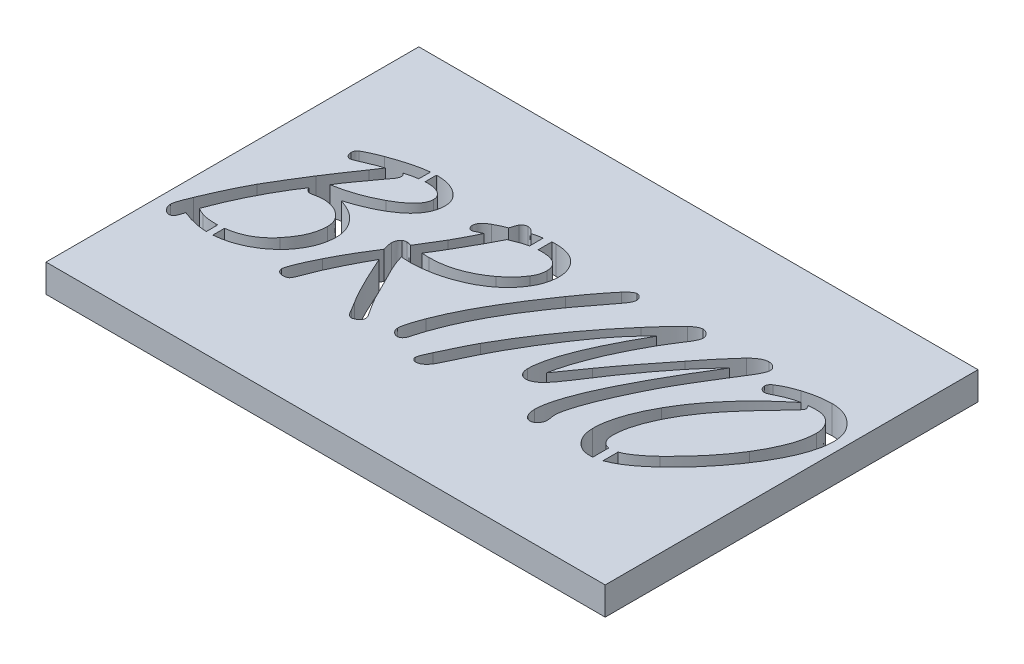
from build123d import *

# Parameters (mm, degrees)
SKETCH1_W           = 30
SKETCH1_H           = 20
BOSS_EXTRUDE1_DEPTH = 1.5
CUT_EXTRUDE1_REACH  = 20.09
SKETCH3_W           = 0.33849078
SKETCH3_H           = 1.82785021
SKETCH3_W_2         = 0.304641701
SKETCH3_H_2         = 1.65860482
SKETCH3_W_3         = 0.406188936
SKETCH3_H_3         = 1.624755742
SKETCH3_W_4         = 0.440038013
SKETCH3_H_4         = 2.200190067
BOSS_EXTRUDE2_DEPTH = 1.5


with BuildPart() as part:
    # Sketch1 → Boss-Extrude1 (new body)
    with BuildSketch(Plane(origin=(0, 0, 0), x_dir=(1, 0, 0), z_dir=(0, 1, 0))):
        Rectangle(SKETCH1_W, SKETCH1_H)
    extrude(amount=BOSS_EXTRUDE1_DEPTH)

    # Sketch2 → Cut-Extrude1 (cut, up to next)
    with BuildSketch(Plane(origin=(0, 1.5, 0), x_dir=(1, 0, 0), z_dir=(0, 1, 0)), mode=Mode.PRIVATE) as cut_extrude1_sk1:
        with BuildLine():
            add(Edge.make_bspline(
                [(-9.932411562, 0.772093525), (-9.734922443, 0.704966672), (-9.379290774, 0.564523072), (-9.062896987, 0.348333913), (-8.939933851, 0.228139394)],
                knots=[0, 0, 0, 0, 0.549380388, 1, 1, 1, 1], degree=3))
            add(Edge.make_bspline(
                [(-8.939933851, 0.228139394), (-8.849928235, 0.139025577), (-8.723492783, -0.000773987), (-8.589062537, -0.207507726), (-8.507650825, -0.366046446), (-8.444563721, -0.529772722), (-8.38551799, -0.757641725), (-8.36781636, -0.934041361), (-8.367350555, -1.052538576)],
                knots=[0, 0, 0, 0, 0.263597717, 0.389785508, 0.511629438, 0.633451834, 0.753742721, 1, 1, 1, 1], degree=3))
            add(Edge.make_bspline(
                [(-8.367350555, -1.052538576), (-8.367907264, -1.197626654), (-8.386165549, -1.41472705), (-8.444352044, -1.698780494), (-8.507863392, -1.908245116), (-8.591319484, -2.113945508), (-8.721756628, -2.391869243), (-8.849344856, -2.587824822), (-8.941842462, -2.714938744)],
                knots=[0, 0, 0, 0, 0.243209893, 0.36414387, 0.485641208, 0.609655764, 0.736110452, 1, 1, 1, 1], degree=3))
            add(Edge.make_bspline(
                [(-8.941842462, -2.714938744), (-9.118329378, -2.955076763), (-9.537742468, -3.391966789), (-10.043554258, -3.724934564), (-10.31604237, -3.860105334)],
                knots=[0, 0, 0, 0, 0.49477109, 1, 1, 1, 1], degree=3))
            add(Edge.make_bspline(
                [(-10.31604237, -3.860105334), (-10.588241604, -3.996085229), (-11.153877319, -4.21133777), (-11.755102182, -4.280881661), (-12.050969755, -4.281908362)],
                knots=[0, 0, 0, 0, 0.507133392, 1, 1, 1, 1], degree=3))
            add(Edge.make_bspline(
                [(-12.050969755, -4.281908362), (-12.292539564, -4.281821037), (-12.803031864, -4.216145988), (-13.293065705, -4.059517856), (-13.543503545, -3.955535884)],
                knots=[0, 0, 0, 0, 0.470723175, 1, 1, 1, 1], degree=3))
            add(Edge.make_bspline(
                [(-13.543503545, -3.955535884), (-13.563516042, -4.002731317), (-13.58401121, -4.081355243), (-13.614036235, -4.156900722), (-13.619847984, -4.186477813)],
                knots=[0, 0, 0, 0, 0.630095785, 1, 1, 1, 1], degree=3))
            add(Edge.make_bspline(
                [(-13.619847984, -4.186477813), (-13.644480231, -4.26629225), (-13.701584488, -4.411365898), (-13.837980731, -4.49190886), (-13.904231021, -4.488038348)],
                knots=[0, 0, 0, 0, 0.574548178, 1, 1, 1, 1], degree=3))
            add(Edge.make_bspline(
                [(-13.904231021, -4.488038348), (-13.970443515, -4.489457698), (-14.109552839, -4.44512091), (-14.20826649, -4.338308909), (-14.249689609, -4.276182529)],
                knots=[0, 0, 0, 0, 0.465807359, 1, 1, 1, 1], degree=3))
            add(Edge.make_bspline(
                [(-14.249689609, -4.276182529), (-14.346980591, -4.140746557), (-14.352754602, -3.974621993)],
                knots=[0, 0, 0, 1, 1, 1], degree=2))
            add(Edge.make_bspline(
                [(-14.352754602, -3.974621993), (-14.353987257, -3.926006953), (-14.337711204, -3.847062033), (-14.310433019, -3.731276582), (-14.275033217, -3.622393778), (-14.232763968, -3.496950023), (-14.161094823, -3.298065206), (-14.092168737, -3.145019308), (-14.049285456, -3.035585389)],
                knots=[0, 0, 0, 0, 0.146035373, 0.243207789, 0.360183195, 0.492362495, 0.644091985, 1, 1, 1, 1], degree=3))
            add(Edge.make_bspline(
                [(-14.049285456, -3.035585389), (-13.950985831, -2.802695194), (-13.805866263, -2.463136544), (-13.610325533, -2.026025995), (-13.470337877, -1.728218258), (-13.336757805, -1.44954224), (-13.173165128, -1.114839692), (-13.046015235, -0.877108513), (-12.961377195, -0.726166098)],
                knots=[0, 0, 0, 0, 0.296923744, 0.433727894, 0.562436716, 0.683432254, 0.796726641, 1, 1, 1, 1], degree=3))
            add(Edge.make_bspline(
                [(-12.961377195, -0.726166098), (-12.901896868, -0.619005257), (-12.800762443, -0.445297068), (-12.652582949, -0.194561766), (-12.509925662, 0.035386032), (-12.352952852, 0.297885607), (-12.100501719, 0.703093337), (-11.90230717, 1.022009126), (-11.762769496, 1.243520438)],
                knots=[0, 0, 0, 0, 0.159440585, 0.26150338, 0.37890007, 0.5114824, 0.659407442, 1, 1, 1, 1], degree=3))
            add(Edge.make_bspline(
                [(-11.762769496, 1.243520438), (-11.690554557, 1.358424372), (-11.573934626, 1.53644885), (-11.410511136, 1.782516741), (-11.2726733, 1.989429928), (-11.124234366, 2.210488963), (-10.903779312, 2.533266977), (-10.730369133, 2.780455239), (-10.613785684, 2.951727269)],
                knots=[0, 0, 0, 0, 0.197743422, 0.310104099, 0.430435127, 0.560023408, 0.698104168, 1, 1, 1, 1], degree=3))
            add(Edge.make_bspline(
                [(-10.613785684, 2.951727269), (-10.43494449, 3.206622426), (-10.270235707, 3.470869456)],
                knots=[0, 0, 0, 1, 1, 1], degree=2))
            add(Edge.make_bspline(
                [(-10.270235707, 3.470869456), (-10.401765356, 3.432653795), (-10.691313001, 3.325587509), (-10.976077772, 3.206746194), (-11.132927872, 3.136862534)],
                knots=[0, 0, 0, 0, 0.443552837, 1, 1, 1, 1], degree=3))
            add(Edge.make_bspline(
                [(-11.132927872, 3.136862534), (-11.248375573, 3.0843222), (-11.419870602, 3.017791597), (-11.593586075, 2.952209285), (-11.652070059, 2.946001436)],
                knots=[0, 0, 0, 0, 0.684267816, 1, 1, 1, 1], degree=3))
            add(Edge.make_bspline(
                [(-11.652070059, 2.946001436), (-11.762863837, 2.952888006), (-11.831479492, 3.041431985)],
                knots=[0, 0, 0, 1, 1, 1], degree=2))
            add(Edge.make_bspline(
                [(-11.831479492, 3.041431985), (-11.908514756, 3.140798702), (-11.907823931, 3.266648081)],
                knots=[0, 0, 0, 1, 1, 1], degree=2))
            add(Edge.make_bspline(
                [(-11.907823931, 3.266648081), (-11.906838025, 3.324020662), (-11.889786006, 3.440246881), (-11.808168266, 3.524857126), (-11.762769496, 3.552939729)],
                knots=[0, 0, 0, 0, 0.520839349, 1, 1, 1, 1], degree=3))
            add(Edge.make_bspline(
                [(-11.762769496, 3.552939729), (-11.645335445, 3.626368505), (-11.337675073, 3.78437993), (-11.015051875, 3.908712824), (-10.821824281, 3.9823772)],
                knots=[0, 0, 0, 0, 0.400792134, 1, 1, 1, 1], degree=3))
            add(Edge.make_bspline(
                [(-10.821824281, 3.9823772), (-10.59891412, 4.062491854), (-10.275121161, 4.182945908), (-9.845503332, 4.303683476), (-9.552522633, 4.38270017), (-9.27493548, 4.438874294), (-8.941278792, 4.494620128), (-8.697451556, 4.513347928), (-8.541034155, 4.512971054)],
                knots=[0, 0, 0, 0, 0.302190604, 0.439786841, 0.568841533, 0.688942376, 0.800686413, 1, 1, 1, 1], degree=3))
            add(Edge.make_bspline(
                [(-8.541034155, 4.512971054), (-8.318813715, 4.511629255), (-7.896315658, 4.472283719), (-7.512243516, 4.290299174), (-7.355786734, 4.173238299)],
                knots=[0, 0, 0, 0, 0.533747536, 1, 1, 1, 1], degree=3))
            add(Edge.make_bspline(
                [(-7.355786734, 4.173238299), (-7.284878907, 4.119338616), (-7.18431349, 4.032911794), (-7.078393914, 3.896915271), (-7.011982214, 3.793582292), (-6.961860527, 3.683694428), (-6.916061927, 3.528042107), (-6.901603736, 3.40611682), (-6.901537319, 3.323906411)],
                knots=[0, 0, 0, 0, 0.267458389, 0.393646815, 0.515248226, 0.634634543, 0.754005651, 1, 1, 1, 1], degree=3))
            add(Edge.make_bspline(
                [(-6.901537319, 3.323906411), (-6.901908339, 3.151241789), (-6.943010372, 2.890257945), (-7.081888539, 2.566237613), (-7.228155541, 2.332143313), (-7.415997886, 2.108012107), (-7.732713098, 1.808728284), (-8.016211109, 1.620712148), (-8.216570288, 1.501182921)],
                knots=[0, 0, 0, 0, 0.219658989, 0.331395792, 0.446658753, 0.569711962, 0.702581043, 1, 1, 1, 1], degree=3))
            add(Edge.make_bspline(
                [(-8.216570288, 1.501182921), (-8.481220011, 1.344103101), (-9.042256473, 1.071101762), (-9.628218225, 0.856802252), (-9.932411562, 0.772093525)],
                knots=[0, 0, 0, 0, 0.493549598, 1, 1, 1, 1], degree=3))
        make_face()
        with BuildLine():
            add(Edge.make_bspline(
                [(-10.968787327, 1.214891273), (-10.580239876, 1.280848353), (-9.811278378, 1.47308783), (-9.086709916, 1.794688255), (-8.739529697, 1.9840615)],
                knots=[0, 0, 0, 0, 0.499167028, 1, 1, 1, 1], degree=3))
            add(Edge.make_bspline(
                [(-8.739529697, 1.9840615), (-8.553842476, 2.083101508), (-8.297379063, 2.240139228), (-7.995893122, 2.47201528), (-7.822295054, 2.639486663), (-7.683701473, 2.804682676), (-7.557933198, 3.02097862), (-7.511037706, 3.195809836), (-7.512292834, 3.310546134)],
                knots=[0, 0, 0, 0, 0.334645337, 0.477361692, 0.604032632, 0.717668097, 0.819210988, 1, 1, 1, 1], degree=3))
            add(Edge.make_bspline(
                [(-7.512292834, 3.310546134), (-7.512690218, 3.405625607), (-7.568433928, 3.613709468), (-7.74527836, 3.737308617), (-7.836756702, 3.78769888)],
                knots=[0, 0, 0, 0, 0.47272119, 1, 1, 1, 1], degree=3))
            add(Edge.make_bspline(
                [(-7.836756702, 3.78769888), (-7.91640754, 3.829234097), (-8.111535568, 3.890944034), (-8.315628421, 3.900497138), (-8.428426107, 3.902215539)],
                knots=[0, 0, 0, 0, 0.441874031, 1, 1, 1, 1], degree=3))
            add(Edge.make_bspline(
                [(-8.428426107, 3.902215539), (-8.605843561, 3.903234173), (-8.987329649, 3.862066424), (-9.359845502, 3.771340749), (-9.556415199, 3.71135444)],
                knots=[0, 0, 0, 0, 0.462913354, 1, 1, 1, 1], degree=3))
            add(Edge.make_bspline(
                [(-9.556415199, 3.71135444), (-9.52029987, 3.688080547), (-9.460008056, 3.628997815), (-9.435543783, 3.548024685), (-9.436172706, 3.509041676)],
                knots=[0, 0, 0, 0, 0.526905379, 1, 1, 1, 1], degree=3))
            add(Edge.make_bspline(
                [(-9.436172706, 3.509041676), (-9.44003055, 3.440617254), (-9.495459905, 3.276389704), (-9.607324279, 3.144545113), (-9.669023247, 3.064335317)],
                knots=[0, 0, 0, 0, 0.400175617, 1, 1, 1, 1], degree=3))
            add(Edge.make_bspline(
                [(-9.669023247, 3.064335317), (-9.705752028, 3.01809389), (-9.798377785, 2.893009368), (-9.890132148, 2.767305174), (-9.945771839, 2.688338953)],
                knots=[0, 0, 0, 0, 0.379369887, 1, 1, 1, 1], degree=3))
            add(Edge.make_bspline(
                [(-9.945771839, 2.688338953), (-9.966055172, 2.660515777), (-9.996622024, 2.609383414), (-10.049857582, 2.537362534), (-10.104205004, 2.464239405), (-10.165964122, 2.376821057), (-10.269155131, 2.236305461), (-10.352052509, 2.125582477), (-10.409564308, 2.047045662)],
                knots=[0, 0, 0, 0, 0.130417069, 0.225441192, 0.339257826, 0.475767101, 0.631065693, 1, 1, 1, 1], degree=3))
            add(Edge.make_bspline(
                [(-10.409564308, 2.047045662), (-10.522937571, 1.894215968), (-10.718008956, 1.622460146), (-10.896930944, 1.339792298), (-10.968787327, 1.214891273)],
                knots=[0, 0, 0, 0, 0.569144572, 1, 1, 1, 1], degree=3))
        make_face(mode=Mode.SUBTRACT)
        with BuildLine():
            add(Edge.make_bspline(
                [(-13.375545778, -3.396312865), (-13.308996022, -3.435608537), (-13.192577438, -3.489816722), (-13.076806058, -3.54562316), (-13.028178579, -3.562362021)],
                knots=[0, 0, 0, 0, 0.600477991, 1, 1, 1, 1], degree=3))
            add(Edge.make_bspline(
                [(-13.028178579, -3.562362021), (-12.915175566, -3.602513301), (-12.651814872, -3.660773776), (-12.382500723, -3.668398525), (-12.23419641, -3.671152847)],
                knots=[0, 0, 0, 0, 0.446321071, 1, 1, 1, 1], degree=3))
            add(Edge.make_bspline(
                [(-12.23419641, -3.671152847), (-11.998570944, -3.668945594), (-11.648826949, -3.643241244), (-11.205710921, -3.524515196), (-10.897201968, -3.406949349), (-10.607718349, -3.254243214), (-10.242209855, -3.003009193), (-10.003891331, -2.764495983), (-9.859884345, -2.59087903)],
                knots=[0, 0, 0, 0, 0.2622613, 0.386546348, 0.508478145, 0.628294186, 0.749249156, 1, 1, 1, 1], degree=3))
            add(Edge.make_bspline(
                [(-9.859884345, -2.59087903), (-9.739428686, -2.446896511), (-9.576843708, -2.224848554), (-9.394520707, -1.916652806), (-9.287290574, -1.691121868), (-9.20433338, -1.466188925), (-9.125960144, -1.171006021), (-9.098832135, -0.945740316), (-9.100257173, -0.796784705)],
                knots=[0, 0, 0, 0, 0.283178931, 0.414402904, 0.539790953, 0.659455139, 0.775649605, 1, 1, 1, 1], degree=3))
            add(Edge.make_bspline(
                [(-9.100257173, -0.796784705), (-9.100920286, -0.701132167), (-9.117000104, -0.558295583), (-9.17895005, -0.379933885), (-9.243683828, -0.256078988), (-9.323417217, -0.138573656), (-9.462300404, 0.008792654), (-9.588239456, 0.10027809), (-9.678566302, 0.155612177)],
                knots=[0, 0, 0, 0, 0.24566119, 0.364900079, 0.482428716, 0.603309602, 0.728040986, 1, 1, 1, 1], degree=3))
            add(Edge.make_bspline(
                [(-9.678566302, 0.155612177), (-9.792993305, 0.225941596), (-10.054700056, 0.329119336), (-10.333915336, 0.359228175), (-10.478274304, 0.359833552)],
                knots=[0, 0, 0, 0, 0.481057088, 1, 1, 1, 1], degree=3))
            add(Edge.make_bspline(
                [(-10.478274304, 0.359833552), (-10.550545611, 0.360065275), (-10.723623634, 0.342604219), (-10.893988447, 0.308385339), (-10.99359927, 0.289214946)],
                knots=[0, 0, 0, 0, 0.415623019, 1, 1, 1, 1], degree=3))
            add(Edge.make_bspline(
                [(-10.99359927, 0.289214946), (-11.055984099, 0.27687241), (-11.119567595, 0.275854669)],
                knots=[0, 0, 0, 1, 1, 1], degree=2))
            add(Edge.make_bspline(
                [(-11.119567595, 0.275854669), (-11.177380583, 0.271924679), (-11.294591777, 0.331356932), (-11.369141284, 0.436742491), (-11.398224798, 0.501070765)],
                knots=[0, 0, 0, 0, 0.439945867, 1, 1, 1, 1], degree=3))
            add(Edge.make_bspline(
                [(-11.398224798, 0.501070765), (-11.498099609, 0.360534755), (-11.647133079, 0.13858681), (-11.83973942, -0.176246001), (-11.993545276, -0.439499763), (-12.154535674, -0.720952073), (-12.375414338, -1.135819467), (-12.542768094, -1.456463944), (-12.652182215, -1.678562979)],
                knots=[0, 0, 0, 0, 0.205494641, 0.318510648, 0.439849182, 0.568892532, 0.704939884, 1, 1, 1, 1], degree=3))
            add(Edge.make_bspline(
                [(-12.652182215, -1.678562979), (-12.777599119, -1.9379236), (-13.038931949, -2.502280157), (-13.258886865, -3.0840647), (-13.375545778, -3.396312865)],
                knots=[0, 0, 0, 0, 0.463573793, 1, 1, 1, 1], degree=3))
        make_face(mode=Mode.SUBTRACT)
    cut_extrude1_tool1 = extrude(cut_extrude1_sk1.sketch, amount=-CUT_EXTRUDE1_REACH, mode=Mode.PRIVATE) & part.part
    # Sketch2 → Cut-Extrude1 (cut, up to next)
    with BuildSketch(Plane(origin=(0, 1.5, 0), x_dir=(1, 0, 0), z_dir=(0, 1, 0)), mode=Mode.PRIVATE) as cut_extrude1_sk2:
        with BuildLine():
            add(Edge.make_bspline(
                [(-6.187716811, -0.945656361), (-6.329970155, -1.203003673), (-6.532999847, -1.579562743), (-6.786317377, -2.071443161), (-6.952063906, -2.408844563), (-7.101265736, -2.725587371), (-7.270336095, -3.104718665), (-7.382865352, -3.381208427), (-7.447400061, -3.56045341)],
                knots=[0, 0, 0, 0, 0.303657402, 0.441760373, 0.571337763, 0.691839577, 0.803309128, 1, 1, 1, 1], degree=3))
            add(Edge.make_bspline(
                [(-7.447400061, -3.56045341), (-7.477914059, -3.6449393), (-7.523254639, -3.76341957), (-7.581641744, -3.910554675), (-7.621619869, -3.996627644), (-7.651742878, -4.069660976), (-7.687958474, -4.133766177), (-7.713377627, -4.173577114), (-7.731783097, -4.192203646)],
                knots=[0, 0, 0, 0, 0.387425393, 0.547465606, 0.682624782, 0.796883394, 0.887789484, 1, 1, 1, 1], degree=3))
            add(Edge.make_bspline(
                [(-7.731783097, -4.192203646), (-7.764761969, -4.227335258), (-7.863742025, -4.269217296), (-7.968779928, -4.282968116), (-8.0276178, -4.281908362)],
                knots=[0, 0, 0, 0, 0.444411731, 1, 1, 1, 1], degree=3))
            add(Edge.make_bspline(
                [(-8.0276178, -4.281908362), (-8.077424791, -4.28290722), (-8.173861351, -4.268791762), (-8.255299797, -4.214850082), (-8.285280283, -4.18075198)],
                knots=[0, 0, 0, 0, 0.525177967, 1, 1, 1, 1], degree=3))
            add(Edge.make_bspline(
                [(-8.285280283, -4.18075198), (-8.361250545, -4.098763028), (-8.367350555, -3.98798227)],
                knots=[0, 0, 0, 1, 1, 1], degree=2))
            add(Edge.make_bspline(
                [(-8.367350555, -3.98798227), (-8.366391471, -3.916519244), (-8.334002328, -3.796455098), (-8.275360465, -3.618205356), (-8.205257558, -3.437565493), (-8.115157694, -3.226723344), (-7.960402884, -2.882020516), (-7.828338771, -2.61132903), (-7.733691708, -2.421012652)],
                knots=[0, 0, 0, 0, 0.125195319, 0.21875003, 0.331978168, 0.467571889, 0.624160889, 1, 1, 1, 1], degree=3))
            add(Edge.make_bspline(
                [(-7.733691708, -2.421012652), (-7.570886934, -2.08848784), (-7.18428256, -1.387605756), (-6.768112597, -0.704014617), (-6.53508401, -0.34253529)],
                knots=[0, 0, 0, 0, 0.46254815, 1, 1, 1, 1], degree=3))
            add(Edge.make_bspline(
                [(-6.53508401, -0.34253529), (-6.564686779, -0.246634251), (-6.602520064, -0.078931298), (-6.631351547, 0.09104511), (-6.63051456, 0.163246621)],
                knots=[0, 0, 0, 0, 0.582414522, 1, 1, 1, 1], degree=3))
            add(Edge.make_bspline(
                [(-6.63051456, 0.163246621), (-6.631220348, 0.239033975), (-6.602040059, 0.388833858), (-6.508912677, 0.510037567), (-6.451105127, 0.554511872)],
                knots=[0, 0, 0, 0, 0.510937499, 1, 1, 1, 1], degree=3))
            add(Edge.make_bspline(
                [(-6.451105127, 0.554511872), (-6.363470892, 0.619707535), (-6.254518196, 0.619404646)],
                knots=[0, 0, 0, 1, 1, 1], degree=2))
            add(Edge.make_bspline(
                [(-6.254518196, 0.619404646), (-6.122155393, 0.613263361), (-6.002581546, 0.554511872)],
                knots=[0, 0, 0, 1, 1, 1], degree=2))
            add(Edge.make_bspline(
                [(-6.002581546, 0.554511872), (-5.974615854, 0.601993759), (-5.922276641, 0.686117862), (-5.841868886, 0.818687279), (-5.755032105, 0.959733175), (-5.651017382, 1.129797106), (-5.476439634, 1.411337154), (-5.341806116, 1.640303607), (-5.241045763, 1.798926234)],
                knots=[0, 0, 0, 0, 0.113303253, 0.203721321, 0.318821536, 0.453890697, 0.61364242, 1, 1, 1, 1], degree=3))
            add(Edge.make_bspline(
                [(-5.241045763, 1.798926234), (-5.155701785, 1.962455651), (-5.025514586, 2.18821245), (-4.878507629, 2.479106859), (-4.785160777, 2.650906112), (-4.713577578, 2.797108836), (-4.64540175, 2.932722613), (-4.605757216, 3.02219776), (-4.588300806, 3.073878372)],
                knots=[0, 0, 0, 0, 0.38615669, 0.545201896, 0.682224125, 0.795389663, 0.885924053, 1, 1, 1, 1], degree=3))
            add(Edge.make_bspline(
                [(-4.588300806, 3.073878372), (-4.739264437, 3.013650655), (-4.882226898, 2.936458381)],
                knots=[0, 0, 0, 1, 1, 1], degree=2))
            add(Edge.make_bspline(
                [(-4.882226898, 2.936458381), (-4.970378089, 2.889307149), (-5.069270774, 2.879200051)],
                knots=[0, 0, 0, 1, 1, 1], degree=2))
            add(Edge.make_bspline(
                [(-5.069270774, 2.879200051), (-5.1680133, 2.885038131), (-5.220051042, 2.970813379)],
                knots=[0, 0, 0, 1, 1, 1], degree=2))
            add(Edge.make_bspline(
                [(-5.220051042, 2.970813379), (-5.26931782, 3.044402245), (-5.267766317, 3.133045312)],
                knots=[0, 0, 0, 1, 1, 1], degree=2))
            add(Edge.make_bspline(
                [(-5.267766317, 3.133045312), (-5.266478668, 3.186631816), (-5.253843498, 3.268975222), (-5.203584626, 3.36832876), (-5.153436159, 3.441987945), (-5.087319307, 3.512666612), (-4.975641341, 3.607836566), (-4.876950608, 3.667141757), (-4.80779107, 3.705628607)],
                knots=[0, 0, 0, 0, 0.209363654, 0.316672459, 0.430564527, 0.554860266, 0.691691821, 1, 1, 1, 1], degree=3))
            add(Edge.make_bspline(
                [(-4.80779107, 3.705628607), (-4.502562347, 3.875530855), (-4.176040834, 3.999554699)],
                knots=[0, 0, 0, 1, 1, 1], degree=2))
            add(Edge.make_bspline(
                [(-4.176040834, 3.999554699), (-4.154478146, 4.086164091), (-4.104408671, 4.219801531), (-4.05903707, 4.355713721), (-4.030986399, 4.402271617)],
                knots=[0, 0, 0, 0, 0.622410319, 1, 1, 1, 1], degree=3))
            add(Edge.make_bspline(
                [(-4.030986399, 4.402271617), (-4.002150297, 4.456035279), (-3.913333544, 4.553000916), (-3.784378752, 4.577690949), (-3.721791419, 4.577863827)],
                knots=[0, 0, 0, 0, 0.492094706, 1, 1, 1, 1], degree=3))
            add(Edge.make_bspline(
                [(-3.721791419, 4.577863827), (-3.645412748, 4.578681563), (-3.48051134, 4.530350696), (-3.367684933, 4.401125125), (-3.317165891, 4.329744399)],
                knots=[0, 0, 0, 0, 0.461819579, 1, 1, 1, 1], degree=3))
            add(Edge.make_bspline(
                [(-3.317165891, 4.329744399), (-3.115165428, 4.387017262), (-2.729223343, 4.47660162), (-2.334523633, 4.512888077), (-2.149095968, 4.512971054)],
                knots=[0, 0, 0, 0, 0.531297587, 1, 1, 1, 1], degree=3))
            add(Edge.make_bspline(
                [(-2.149095968, 4.512971054), (-2.023747951, 4.515580856), (-1.841878837, 4.50023691), (-1.608070545, 4.457474307), (-1.450778766, 4.408949952), (-1.303473031, 4.351251225), (-1.128511882, 4.249489073), (-1.00792471, 4.15968259), (-0.940945215, 4.085442193)],
                knots=[0, 0, 0, 0, 0.284878145, 0.414697497, 0.540253114, 0.659139966, 0.773941983, 1, 1, 1, 1], degree=3))
            add(Edge.make_bspline(
                [(-0.940945215, 4.085442193), (-0.814457253, 3.955569121), (-0.610002808, 3.642776901), (-0.550020564, 3.274412577), (-0.549679963, 3.091055871)],
                knots=[0, 0, 0, 0, 0.49660938, 1, 1, 1, 1], degree=3))
            add(Edge.make_bspline(
                [(-0.549679963, 3.091055871), (-0.552524051, 2.933204486), (-0.572727247, 2.694726054), (-0.659755754, 2.387876569), (-0.745267134, 2.158976867), (-0.858294785, 1.934045589), (-1.048610695, 1.633916435), (-1.217297448, 1.420720631), (-1.345570744, 1.28741849)],
                knots=[0, 0, 0, 0, 0.234942609, 0.352533612, 0.47274128, 0.597393328, 0.725590222, 1, 1, 1, 1], degree=3))
            add(Edge.make_bspline(
                [(-1.345570744, 1.28741849), (-1.470339199, 1.152689902), (-1.67741866, 0.967364724), (-1.974612111, 0.741420373), (-2.217385223, 0.585081745), (-2.474021711, 0.437598168), (-2.845639443, 0.258154541), (-3.136241634, 0.139589728), (-3.338160612, 0.073541904)],
                knots=[0, 0, 0, 0, 0.233457707, 0.35316875, 0.474930929, 0.600809766, 0.72976489, 1, 1, 1, 1], degree=3))
            add(Edge.make_bspline(
                [(-3.338160612, 0.073541904), (-3.646961461, -0.030804684), (-4.267667313, -0.192811819), (-4.906705967, -0.250254772), (-5.220051042, -0.250921963)],
                knots=[0, 0, 0, 0, 0.509985611, 1, 1, 1, 1], degree=3))
            add(Edge.make_bspline(
                [(-5.220051042, -0.250921963), (-5.28687769, -0.25000035), (-5.447898693, -0.244831523), (-5.608790767, -0.236666647), (-5.702929621, -0.231835853)],
                knots=[0, 0, 0, 0, 0.414851765, 1, 1, 1, 1], degree=3))
            add(Edge.make_bspline(
                [(-5.702929621, -0.231835853), (-5.587473829, -0.639977326), (-5.407094919, -1.023909412)],
                knots=[0, 0, 0, 1, 1, 1], degree=2))
            add(Edge.make_bspline(
                [(-5.407094919, -1.023909412), (-5.347456199, -1.143286294), (-5.251268059, -1.329621889), (-5.119787114, -1.590576489), (-5.008758921, -1.812765223), (-4.889583118, -2.052515419), (-4.708834997, -2.405246114), (-4.573796416, -2.680652215), (-4.47950998, -2.869536233)],
                knots=[0, 0, 0, 0, 0.193804377, 0.304548058, 0.424381803, 0.554546043, 0.693390359, 1, 1, 1, 1], degree=3))
            add(Edge.make_bspline(
                [(-4.47950998, -2.869536233), (-4.405889638, -3.000270718), (-4.22348637, -3.307911789), (-4.027778917, -3.607287565), (-3.912652518, -3.779943673)],
                knots=[0, 0, 0, 0, 0.419594051, 1, 1, 1, 1], degree=3))
            add(Edge.make_bspline(
                [(-3.912652518, -3.779943673), (-3.817882162, -3.908227388), (-3.807678914, -4.066235321)],
                knots=[0, 0, 0, 1, 1, 1], degree=2))
            add(Edge.make_bspline(
                [(-3.807678914, -4.066235321), (-3.806843348, -4.109688435), (-3.843342246, -4.202620521), (-3.915776497, -4.270325684), (-3.960367792, -4.300994472)],
                knots=[0, 0, 0, 0, 0.439346742, 1, 1, 1, 1], degree=3))
            add(Edge.make_bspline(
                [(-3.960367792, -4.300994472), (-4.005263576, -4.334513934), (-4.093858202, -4.374123188), (-4.18643093, -4.406831969), (-4.229481941, -4.404059465)],
                knots=[0, 0, 0, 0, 0.568772301, 1, 1, 1, 1], degree=3))
            add(Edge.make_bspline(
                [(-4.229481941, -4.404059465), (-4.30249074, -4.401384003), (-4.453806675, -4.283190101), (-4.542625614, -4.120653529), (-4.59593525, -4.018520046)],
                knots=[0, 0, 0, 0, 0.374193586, 1, 1, 1, 1], degree=3))
            add(Edge.make_bspline(
                [(-4.59593525, -4.018520046), (-4.715855362, -3.817344341), (-4.838328845, -3.617711739)],
                knots=[0, 0, 0, 1, 1, 1], degree=2))
            add(Edge.make_bspline(
                [(-4.838328845, -3.617711739), (-4.937010583, -3.462352189), (-5.089126625, -3.2122345), (-5.282701104, -2.84906382), (-5.447937501, -2.531481916), (-5.620500619, -2.181254143), (-5.872325819, -1.650752661), (-6.058983113, -1.233968571), (-6.187716811, -0.945656361)],
                knots=[0, 0, 0, 0, 0.184322031, 0.292918609, 0.412014528, 0.542779874, 0.683828761, 1, 1, 1, 1], degree=3))
        make_face()
        with BuildLine():
            add(Edge.make_bspline(
                [(-5.33265909, 0.495344932), (-5.255748495, 0.490240797), (-5.123956244, 0.488367805), (-4.992364255, 0.479915117), (-4.937576616, 0.481984655)],
                knots=[0, 0, 0, 0, 0.584631421, 1, 1, 1, 1], degree=3))
            add(Edge.make_bspline(
                [(-4.937576616, 0.481984655), (-4.70212415, 0.484606384), (-4.348489728, 0.50858086), (-3.888457715, 0.607980937), (-3.549219917, 0.705832305), (-3.217500202, 0.837901661), (-2.776958615, 1.051689994), (-2.462691252, 1.251154779), (-2.261704016, 1.400026538)],
                knots=[0, 0, 0, 0, 0.245680727, 0.367674, 0.490007431, 0.613271902, 0.739317888, 1, 1, 1, 1], degree=3))
            add(Edge.make_bspline(
                [(-2.261704016, 1.400026538), (-2.083381491, 1.530114125), (-1.757242928, 1.816699255), (-1.489163255, 2.158223383), (-1.37610852, 2.337154532)],
                knots=[0, 0, 0, 0, 0.510600506, 1, 1, 1, 1], degree=3))
            add(Edge.make_bspline(
                [(-1.37610852, 2.337154532), (-1.309000695, 2.442390019), (-1.195131882, 2.664903045), (-1.160948329, 2.912697034), (-1.160435478, 3.033797541)],
                knots=[0, 0, 0, 0, 0.507981551, 1, 1, 1, 1], degree=3))
            add(Edge.make_bspline(
                [(-1.160435478, 3.033797541), (-1.15811821, 3.145270519), (-1.187323203, 3.309650952), (-1.300702219, 3.494015783), (-1.419751585, 3.600138508), (-1.569515064, 3.683565944), (-1.829313433, 3.765916159), (-2.0468033, 3.779097465), (-2.198719854, 3.780064436)],
                knots=[0, 0, 0, 0, 0.230322495, 0.334117835, 0.44095604, 0.555574235, 0.685495486, 1, 1, 1, 1], degree=3))
            add(Edge.make_bspline(
                [(-2.198719854, 3.780064436), (-2.356673278, 3.780802701), (-2.679012825, 3.752251615), (-2.991977209, 3.670105949), (-3.147299513, 3.615923891)],
                knots=[0, 0, 0, 0, 0.489735181, 1, 1, 1, 1], degree=3))
            add(Edge.make_bspline(
                [(-3.147299513, 3.615923891), (-3.223606553, 3.591266746), (-3.400898274, 3.520534678), (-3.578299333, 3.450251398), (-3.679801978, 3.405976683)],
                knots=[0, 0, 0, 0, 0.419900539, 1, 1, 1, 1], degree=3))
            add(Edge.make_bspline(
                [(-3.679801978, 3.405976683), (-3.724815277, 3.311761603), (-3.798036326, 3.163169154), (-3.907548533, 2.958716122), (-4.001148465, 2.782191634), (-4.103844079, 2.591757221), (-4.21708588, 2.387243618), (-4.338702984, 2.168088722), (-4.467968948, 1.939749364), (-4.598713707, 1.712170628), (-4.724596981, 1.494537022), (-4.842971447, 1.292245759), (-4.953855945, 1.10429125), (-5.058513424, 0.931427725), (-5.18275135, 0.729057637), (-5.273238463, 0.585345449), (-5.33265909, 0.495344932)],
                knots=[0, 0, 0, 0, 0.093552085, 0.148370518, 0.20778203, 0.272558871, 0.342203182, 0.417217165, 0.497105204, 0.577275373, 0.652356453, 0.722349744, 0.78725685, 0.847862099, 0.903387135, 1, 1, 1, 1], degree=3))
        make_face(mode=Mode.SUBTRACT)
    cut_extrude1_tool2 = extrude(cut_extrude1_sk2.sketch, amount=-CUT_EXTRUDE1_REACH, mode=Mode.PRIVATE) & part.part
    # Sketch2 → Cut-Extrude1 (cut, up to next)
    with BuildSketch(Plane(origin=(0, 1.5, 0), x_dir=(1, 0, 0), z_dir=(0, 1, 0)), mode=Mode.PRIVATE) as cut_extrude1_sk3:
        with BuildLine():
            add(Edge.make_bspline(
                [(2.322779568, 4.390819951), (2.452144558, 4.382707041), (2.536543998, 4.282029125)],
                knots=[0, 0, 0, 1, 1, 1], degree=2))
            add(Edge.make_bspline(
                [(2.536543998, 4.282029125), (2.622212222, 4.193061656), (2.626248714, 4.070173306)],
                knots=[0, 0, 0, 1, 1, 1], degree=2))
            add(Edge.make_bspline(
                [(2.626248714, 4.070173306), (2.624797028, 4.005079263), (2.578217867, 3.85033617), (2.490902491, 3.715480594), (2.441113449, 3.635010001)],
                knots=[0, 0, 0, 0, 0.404556824, 1, 1, 1, 1], degree=3))
            add(Edge.make_bspline(
                [(2.441113449, 3.635010001), (2.41738825, 3.598772442), (2.369842415, 3.537690316), (2.299120554, 3.44121861), (2.2218726, 3.340101836), (2.13156193, 3.218239338), (1.977329658, 3.018515823), (1.853680997, 2.859501594), (1.767373771, 2.745597282)],
                knots=[0, 0, 0, 0, 0.11634101, 0.20802167, 0.321595944, 0.458431798, 0.615802325, 1, 1, 1, 1], degree=3))
            add(Edge.make_bspline(
                [(1.767373771, 2.745597282), (1.54498383, 2.459953727), (1.221240311, 2.032995447), (0.810083269, 1.459637538), (0.522105499, 1.040096547), (0.249517746, 0.6252089), (-0.011500772, 0.217711123), (-0.252567204, -0.186988031), (-0.480739215, -0.585109242), (-0.69462873, -0.977048454), (-0.89185079, -1.365356294), (-1.071763812, -1.74880099), (-1.241862857, -2.124731547), (-1.391902989, -2.497107925), (-1.56997337, -2.979775944), (-1.688832574, -3.341525968), (-1.754013495, -3.583356742)],
                knots=[0, 0, 0, 0, 0.149039144, 0.220561208, 0.290451295, 0.358519865, 0.424932544, 0.489661285, 0.55242708, 0.613842143, 0.67346501, 0.731695476, 0.788208216, 0.843315331, 0.896932694, 1, 1, 1, 1], degree=3))
            add(Edge.make_bspline(
                [(-1.754013495, -3.583356742), (-1.764517529, -3.65200303), (-1.794638943, -3.744917835), (-1.843375571, -3.858847389), (-1.889244943, -3.922552754), (-1.937247869, -3.975777927), (-2.015153569, -4.023321415), (-2.081662521, -4.036873364), (-2.126192637, -4.037606156)],
                knots=[0, 0, 0, 0, 0.323177975, 0.457887321, 0.577798346, 0.689538179, 0.791287805, 1, 1, 1, 1], degree=3))
            add(Edge.make_bspline(
                [(-2.126192637, -4.037606156), (-2.176148326, -4.04071691), (-2.275766187, -4.008383445), (-2.35953054, -3.946631607), (-2.393398174, -3.904003387)],
                knots=[0, 0, 0, 0, 0.476202804, 1, 1, 1, 1], degree=3))
            add(Edge.make_bspline(
                [(-2.393398174, -3.904003387), (-2.427454692, -3.865734777), (-2.484682189, -3.779290964), (-2.503168751, -3.677266702), (-2.504097611, -3.627254794)],
                knots=[0, 0, 0, 0, 0.506247232, 1, 1, 1, 1], degree=3))
            add(Edge.make_bspline(
                [(-2.504097611, -3.627254794), (-2.50290337, -3.562460114), (-2.488864559, -3.456937314), (-2.457772725, -3.305221814), (-2.422076348, -3.165527808), (-2.371922262, -3.010083891), (-2.296184216, -2.76533153), (-2.224327725, -2.576058202), (-2.173907911, -2.443915984)],
                knots=[0, 0, 0, 0, 0.157377568, 0.25846142, 0.376715766, 0.507925444, 0.655757051, 1, 1, 1, 1], degree=3))
            add(Edge.make_bspline(
                [(-2.173907911, -2.443915984), (-2.037834517, -2.088523914), (-1.803248914, -1.547298895), (-1.436173534, -0.82340597), (-1.114571776, -0.239891296), (-0.757390823, 0.369477879), (-0.215415857, 1.236941466), (0.226509612, 1.889003243), (0.536319687, 2.329520088)],
                knots=[0, 0, 0, 0, 0.207457769, 0.321317991, 0.442402316, 0.570661728, 0.706370098, 1, 1, 1, 1], degree=3))
            add(Edge.make_bspline(
                [(0.536319687, 2.329520088), (0.661729673, 2.508479988), (0.844391377, 2.769081866), (1.089817705, 3.098686351), (1.254616806, 3.323272569), (1.413841762, 3.52706999), (1.603743953, 3.766225002), (1.743480562, 3.935209321), (1.836083767, 4.03963553)],
                knots=[0, 0, 0, 0, 0.305094517, 0.444182828, 0.573676136, 0.693947465, 0.805189754, 1, 1, 1, 1], degree=3))
            add(Edge.make_bspline(
                [(1.836083767, 4.03963553), (1.922478503, 4.136327329), (2.066816683, 4.278834624), (2.245047501, 4.387531161), (2.322779568, 4.390819951)],
                knots=[0, 0, 0, 0, 0.632297704, 1, 1, 1, 1], degree=3))
        make_face()
    cut_extrude1_tool3 = extrude(cut_extrude1_sk3.sketch, amount=-CUT_EXTRUDE1_REACH, mode=Mode.PRIVATE) & part.part
    # Sketch2 → Cut-Extrude1 (cut, up to next)
    with BuildSketch(Plane(origin=(0, 1.5, 0), x_dir=(1, 0, 0), z_dir=(0, 1, 0)), mode=Mode.PRIVATE) as cut_extrude1_sk4:
        with BuildLine():
            add(Edge.make_bspline(
                [(3.574828374, -1.716735199), (3.625156357, -1.650273132), (3.706815652, -1.534994143), (3.828896818, -1.365074739), (3.948070052, -1.197895032), (4.084565552, -1.004284449), (4.302747087, -0.693340074), (4.47875478, -0.4498567), (4.597843861, -0.275733906)],
                knots=[0, 0, 0, 0, 0.141498952, 0.239801791, 0.355178915, 0.490017753, 0.641932105, 1, 1, 1, 1], degree=3))
            add(Edge.make_bspline(
                [(4.597843861, -0.275733906), (4.725670045, -0.09319348), (4.932459258, 0.192157261), (5.229293393, 0.587665), (5.485981961, 0.926391559), (5.767117614, 1.291640418), (6.190094003, 1.832373412), (6.519698065, 2.251469545), (6.750757052, 2.537558685)],
                knots=[0, 0, 0, 0, 0.188685977, 0.298363889, 0.418709603, 0.548544633, 0.688630665, 1, 1, 1, 1], degree=3))
            add(Edge.make_bspline(
                [(6.750757052, 2.537558685), (7.006502422, 2.868976437), (7.492090964, 3.47526074), (8.002117553, 4.061166759), (8.245199452, 4.324018566)],
                knots=[0, 0, 0, 0, 0.539038236, 1, 1, 1, 1], degree=3))
            add(Edge.make_bspline(
                [(8.245199452, 4.324018566), (8.371196173, 4.446687403), (8.605109497, 4.646513692), (8.895429298, 4.757537352), (9.025821345, 4.75727326)],
                knots=[0, 0, 0, 0, 0.579560941, 1, 1, 1, 1], degree=3))
            add(Edge.make_bspline(
                [(9.025821345, 4.75727326), (9.086483971, 4.75712919), (9.206478762, 4.740005457), (9.30858775, 4.674637126), (9.350285212, 4.635122157)],
                knots=[0, 0, 0, 0, 0.514530336, 1, 1, 1, 1], degree=3))
            add(Edge.make_bspline(
                [(9.350285212, 4.635122157), (9.386204873, 4.605603426), (9.449864735, 4.532334934), (9.465587101, 4.436764885), (9.466710482, 4.390819951)],
                knots=[0, 0, 0, 0, 0.502535384, 1, 1, 1, 1], degree=3))
            add(Edge.make_bspline(
                [(9.466710482, 4.390819951), (9.46529856, 4.292198469), (9.38052339, 4.05327112), (9.258937609, 3.83406253), (9.176601613, 3.703719997)],
                knots=[0, 0, 0, 0, 0.386930444, 1, 1, 1, 1], degree=3))
            add(Edge.make_bspline(
                [(9.176601613, 3.703719997), (9.159315299, 3.671453409), (9.120810815, 3.61468415), (9.065443714, 3.519995217), (9.000016775, 3.415343486), (8.919759931, 3.28792507), (8.785892527, 3.070588649), (8.676041106, 2.897564944), (8.598292484, 2.774226447)],
                knots=[0, 0, 0, 0, 0.100185586, 0.187791225, 0.300521732, 0.438384054, 0.600456246, 1, 1, 1, 1], degree=3))
            add(Edge.make_bspline(
                [(8.598292484, 2.774226447), (8.455066336, 2.542450981), (8.249498611, 2.207606959), (7.989171757, 1.778857121), (7.822488446, 1.496626085), (7.674183482, 1.242174974), (7.511153628, 0.957015899), (7.399476083, 0.756106873), (7.334792013, 0.628947701)],
                knots=[0, 0, 0, 0, 0.328237109, 0.473354262, 0.604276688, 0.723114191, 0.828163182, 1, 1, 1, 1], degree=3))
            add(Edge.make_bspline(
                [(7.334792013, 0.628947701), (7.190753809, 0.347584278), (6.980357699, -0.06518579), (6.721767596, -0.610652867), (6.549007011, -0.994390545), (6.387321677, -1.359777598), (6.202314598, -1.814930869), (6.073344382, -2.148910683), (6.000672935, -2.369480156)],
                knots=[0, 0, 0, 0, 0.288710498, 0.423089182, 0.551295897, 0.673070783, 0.787990006, 1, 1, 1, 1], degree=3))
            add(Edge.make_bspline(
                [(6.000672935, -2.369480156), (5.964832106, -2.484746691), (5.908994715, -2.649130579), (5.85012125, -2.86322262), (5.816388796, -3.004787914), (5.786210904, -3.134083578), (5.762956175, -3.282377761), (5.752628722, -3.387708302), (5.752553507, -3.453571195)],
                knots=[0, 0, 0, 0, 0.324552399, 0.466454955, 0.596706769, 0.715802413, 0.823210811, 1, 1, 1, 1], degree=3))
            add(Edge.make_bspline(
                [(5.752553507, -3.453571195), (5.752975875, -3.534410545), (5.767822395, -3.613894517)],
                knots=[0, 0, 0, 1, 1, 1], degree=2))
            add(Edge.make_bspline(
                [(5.767822395, -3.613894517), (5.775388478, -3.680228757), (5.79253858, -3.778160283), (5.801051391, -3.877190486), (5.802177392, -3.90972922)],
                knots=[0, 0, 0, 0, 0.67222898, 1, 1, 1, 1], degree=3))
            add(Edge.make_bspline(
                [(5.802177392, -3.90972922), (5.801228123, -3.970801739), (5.777304224, -4.101021901), (5.697791656, -4.206967194), (5.653305736, -4.257096419)],
                knots=[0, 0, 0, 0, 0.475441412, 1, 1, 1, 1], degree=3))
            add(Edge.make_bspline(
                [(5.653305736, -4.257096419), (5.614624155, -4.301008171), (5.52779525, -4.378409396), (5.414307498, -4.402869592), (5.361288255, -4.404059465)],
                knots=[0, 0, 0, 0, 0.526091911, 1, 1, 1, 1], degree=3))
            add(Edge.make_bspline(
                [(5.361288255, -4.404059465), (5.298974481, -4.406078662), (5.169205155, -4.360066109), (5.081348336, -4.254682583), (5.048276054, -4.192203646)],
                knots=[0, 0, 0, 0, 0.463852645, 1, 1, 1, 1], degree=3))
            add(Edge.make_bspline(
                [(5.048276054, -4.192203646), (5.012409384, -4.131960422), (4.957293678, -3.984389583), (4.946904336, -3.827328458), (4.947119671, -3.741771453)],
                knots=[0, 0, 0, 0, 0.449010645, 1, 1, 1, 1], degree=3))
            add(Edge.make_bspline(
                [(4.947119671, -3.741771453), (4.948930861, -3.570738031), (4.979121832, -3.299627019), (5.063831859, -2.924788379), (5.153504657, -2.600335438), (5.270918523, -2.249031964), (5.415473019, -1.871006867), (5.583375492, -1.464907328), (5.776910475, -1.030898459), (5.996332669, -0.569450345), (6.243333757, -0.08144058), (6.514635643, 0.434800863), (6.812682219, 0.977684441), (7.134956975, 1.548954589), (7.614737468, 2.366145894), (7.990621403, 2.990893805), (8.254742507, 3.413611127)],
                knots=[0, 0, 0, 0, 0.064534811, 0.102660293, 0.145036482, 0.191610093, 0.242479701, 0.297850307, 0.357543802, 0.421917404, 0.490791198, 0.564085417, 0.642145788, 0.724664023, 0.811774897, 1, 1, 1, 1], degree=3))
            add(Edge.make_bspline(
                [(8.254742507, 3.413611127), (7.960337423, 3.112432411), (7.52151625, 2.629079982), (6.949307614, 1.936721707), (6.495007746, 1.356684386), (6.032058002, 0.728833542), (5.378634131, -0.189190745), (4.902133289, -0.913877637), (4.580666362, -1.411357441)],
                knots=[0, 0, 0, 0, 0.207979829, 0.32223088, 0.443537812, 0.571796138, 0.70745016, 1, 1, 1, 1], degree=3))
            add(Edge.make_bspline(
                [(4.580666362, -1.411357441), (4.511663195, -1.516742088), (4.411035127, -1.6685046), (4.272652366, -1.85630605), (4.179569366, -1.979368239), (4.089725018, -2.087629326), (3.984098181, -2.209113018), (3.902751756, -2.289223935), (3.847759744, -2.335125158)],
                knots=[0, 0, 0, 0, 0.319607252, 0.46163329, 0.591714239, 0.710941077, 0.818427357, 1, 1, 1, 1], degree=3))
            add(Edge.make_bspline(
                [(3.847759744, -2.335125158), (3.764694133, -2.403563939), (3.602768498, -2.521444928), (3.408186087, -2.571262177), (3.319074502, -2.57179292)],
                knots=[0, 0, 0, 0, 0.549889582, 1, 1, 1, 1], degree=3))
            add(Edge.make_bspline(
                [(3.319074502, -2.57179292), (3.244928041, -2.57105532), (3.091386443, -2.542887223), (2.985036251, -2.427956379), (2.950712582, -2.363754323)],
                knots=[0, 0, 0, 0, 0.506515975, 1, 1, 1, 1], degree=3))
            add(Edge.make_bspline(
                [(2.950712582, -2.363754323), (2.869763791, -2.212815431), (2.87055092, -2.041199066)],
                knots=[0, 0, 0, 1, 1, 1], degree=2))
            add(Edge.make_bspline(
                [(2.87055092, -2.041199066), (2.870547537, -1.900038118), (2.88861587, -1.680658101), (2.938210896, -1.380917169), (2.992247719, -1.133898019), (3.061670875, -0.873224078), (3.143388448, -0.597064567), (3.243226401, -0.307781831), (3.358386818, -0.004692456), (3.486068686, 0.313487956), (3.631423105, 0.644688737), (3.7923431, 0.989636093), (3.965670298, 1.34997033), (4.157838423, 1.722806137), (4.434167992, 2.25426293), (4.661857294, 2.652973392), (4.815425513, 2.925006715)],
                knots=[0, 0, 0, 0, 0.078656546, 0.122517565, 0.169349985, 0.219605044, 0.272922603, 0.329917685, 0.390210605, 0.453720347, 0.521083884, 0.591877562, 0.66597922, 0.744043914, 0.825770676, 1, 1, 1, 1], degree=3))
            add(Edge.make_bspline(
                [(4.815425513, 2.925006715), (4.574357654, 2.699812625), (4.098852169, 2.212041182), (3.671063575, 1.681971087), (3.460311715, 1.401935149)],
                knots=[0, 0, 0, 0, 0.484815639, 1, 1, 1, 1], degree=3))
            add(Edge.make_bspline(
                [(3.460311715, 1.401935149), (3.069788649, 0.875373232), (2.331786627, -0.19654265), (1.664152658, -1.31363514), (1.353205188, -1.878967133)],
                knots=[0, 0, 0, 0, 0.503987854, 1, 1, 1, 1], degree=3))
            add(Edge.make_bspline(
                [(1.353205188, -1.878967133), (1.27551325, -2.024605647), (1.152648825, -2.249713985), (0.993283132, -2.565517992), (0.863748214, -2.827438888), (0.72604464, -3.105647646), (0.530208321, -3.510071549), (0.384766771, -3.823782336), (0.284383037, -4.037606156)],
                knots=[0, 0, 0, 0, 0.205562223, 0.319294045, 0.440464432, 0.569430801, 0.705846981, 1, 1, 1, 1], degree=3))
            add(Edge.make_bspline(
                [(0.284383037, -4.037606156), (0.236111508, -4.141644416), (0.161584988, -4.288333641), (0.04195372, -4.459325335), (-0.048604159, -4.55729713), (-0.140115071, -4.636221107), (-0.267370246, -4.707665658), (-0.371844496, -4.731943249), (-0.440889137, -4.732340554)],
                knots=[0, 0, 0, 0, 0.32503491, 0.464530395, 0.589491345, 0.702070162, 0.805323323, 1, 1, 1, 1], degree=3))
            add(Edge.make_bspline(
                [(-0.440889137, -4.732340554), (-0.547685332, -4.730578231), (-0.616481348, -4.648361671)],
                knots=[0, 0, 0, 1, 1, 1], degree=2))
            add(Edge.make_bspline(
                [(-0.616481348, -4.648361671), (-0.672861155, -4.589001511), (-0.671831066, -4.507124458)],
                knots=[0, 0, 0, 1, 1, 1], degree=2))
            add(Edge.make_bspline(
                [(-0.671831066, -4.507124458), (-0.671638586, -4.47687734), (-0.65676603, -4.426946803), (-0.634718793, -4.350499115), (-0.605517699, -4.273819797), (-0.569413032, -4.183121794), (-0.502522582, -4.037611799), (-0.453096731, -3.919691572), (-0.412259973, -3.839110614)],
                knots=[0, 0, 0, 0, 0.124732581, 0.216248139, 0.332116657, 0.466662587, 0.623496912, 1, 1, 1, 1], degree=3))
            add(Edge.make_bspline(
                [(-0.412259973, -3.839110614), (-0.328223045, -3.651867309), (-0.1987099, -3.38570694), (-0.038054815, -3.041085317), (0.072933791, -2.815988368), (0.172987382, -2.609910784), (0.295813905, -2.380589913), (0.375877854, -2.214664161), (0.435163304, -2.115634895)],
                knots=[0, 0, 0, 0, 0.320471249, 0.462249243, 0.593780093, 0.712419213, 0.819963734, 1, 1, 1, 1], degree=3))
            add(Edge.make_bspline(
                [(0.435163304, -2.115634895), (0.686913805, -1.668333344), (1.080266805, -1.006185303), (1.640966524, -0.145633155), (2.078098804, 0.490191161), (2.532622579, 1.116316338), (3.16171706, 1.939810922), (3.659513802, 2.538564542), (4.000448623, 2.930732548)],
                knots=[0, 0, 0, 0, 0.248788223, 0.373149088, 0.497771941, 0.622736917, 0.748123495, 1, 1, 1, 1], degree=3))
            add(Edge.make_bspline(
                [(4.000448623, 2.930732548), (4.130051745, 3.083292662), (4.321977072, 3.296167928), (4.564088357, 3.568085877), (4.723404366, 3.736587124), (4.862292527, 3.88709073), (5.015508799, 4.04380268), (5.121752522, 4.151462017), (5.191421877, 4.211410518)],
                knots=[0, 0, 0, 0, 0.343163112, 0.491461702, 0.624213396, 0.740750024, 0.842578986, 1, 1, 1, 1], degree=3))
            add(Edge.make_bspline(
                [(5.191421877, 4.211410518), (5.287829709, 4.292881581), (5.45130925, 4.436032333), (5.656950503, 4.510186607), (5.744919063, 4.512971054)],
                knots=[0, 0, 0, 0, 0.593681889, 1, 1, 1, 1], degree=3))
            add(Edge.make_bspline(
                [(5.744919063, 4.512971054), (5.899340048, 4.505921942), (6.012124601, 4.398454395)],
                knots=[0, 0, 0, 1, 1, 1], degree=2))
            add(Edge.make_bspline(
                [(6.012124601, 4.398454395), (6.059129658, 4.358479159), (6.141055645, 4.267971107), (6.169089224, 4.14908705), (6.168630701, 4.093076637)],
                knots=[0, 0, 0, 0, 0.526498657, 1, 1, 1, 1], degree=3))
            add(Edge.make_bspline(
                [(6.168630701, 4.093076637), (6.166506189, 4.002964514), (6.079376908, 3.782939964), (5.960853357, 3.581860654), (5.878521832, 3.461326402)],
                knots=[0, 0, 0, 0, 0.378238535, 1, 1, 1, 1], degree=3))
            add(Edge.make_bspline(
                [(5.878521832, 3.461326402), (5.593817886, 3.031467901), (5.044649407, 2.117707555), (4.574674604, 1.1608215), (4.349724433, 0.659485477)],
                knots=[0, 0, 0, 0, 0.484050849, 1, 1, 1, 1], degree=3))
            add(Edge.make_bspline(
                [(4.349724433, 0.659485477), (4.253544488, 0.437020898), (4.12209635, 0.107181837), (3.958557925, -0.32484709), (3.85601674, -0.62885288), (3.76522324, -0.919414518), (3.667864373, -1.279439497), (3.603574909, -1.543544126), (3.574828374, -1.716735199)],
                knots=[0, 0, 0, 0, 0.290271198, 0.425315297, 0.553286498, 0.674536736, 0.789903363, 1, 1, 1, 1], degree=3))
        make_face()
    cut_extrude1_tool4 = extrude(cut_extrude1_sk4.sketch, amount=-CUT_EXTRUDE1_REACH, mode=Mode.PRIVATE) & part.part
    # Sketch2 → Cut-Extrude1 (cut, up to next)
    with BuildSketch(Plane(origin=(0, 1.5, 0), x_dir=(1, 0, 0), z_dir=(0, 1, 0)), mode=Mode.PRIVATE) as cut_extrude1_sk5:
        with BuildLine():
            add(Edge.make_bspline(
                [(11.772312551, 3.726623328), (11.581860816, 3.694645476), (11.165256116, 3.573751041), (10.773433016, 3.388475093), (10.560344576, 3.280008358)],
                knots=[0, 0, 0, 0, 0.446222829, 1, 1, 1, 1], degree=3))
            add(Edge.make_bspline(
                [(10.560344576, 3.280008358), (10.448061918, 3.215144438), (10.319859592, 3.203663919)],
                knots=[0, 0, 0, 1, 1, 1], degree=2))
            add(Edge.make_bspline(
                [(10.319859592, 3.203663919), (10.207489787, 3.212576822), (10.127089883, 3.293368635)],
                knots=[0, 0, 0, 1, 1, 1], degree=2))
            add(Edge.make_bspline(
                [(10.127089883, 3.293368635), (10.033462206, 3.390965636), (10.031659334, 3.526219175)],
                knots=[0, 0, 0, 1, 1, 1], degree=2))
            add(Edge.make_bspline(
                [(10.031659334, 3.526219175), (10.031899867, 3.577559019), (10.067550059, 3.687661983), (10.155071426, 3.762813138), (10.203434322, 3.797241935)],
                knots=[0, 0, 0, 0, 0.459019945, 1, 1, 1, 1], degree=3))
            add(Edge.make_bspline(
                [(10.203434322, 3.797241935), (10.353585239, 3.894956043), (10.687272793, 4.084231132), (11.04947353, 4.210681676), (11.241718698, 4.274394681)],
                knots=[0, 0, 0, 0, 0.469139271, 1, 1, 1, 1], degree=3))
            add(Edge.make_bspline(
                [(11.241718698, 4.274394681), (11.478937819, 4.350456165), (11.941725102, 4.469038024), (12.41757614, 4.511735527), (12.644547771, 4.512971054)],
                knots=[0, 0, 0, 0, 0.523430387, 1, 1, 1, 1], degree=3))
            add(Edge.make_bspline(
                [(12.644547771, 4.512971054), (12.777606614, 4.514911739), (12.973481407, 4.497126281), (13.224297381, 4.439266916), (13.400773971, 4.383768694), (13.565347911, 4.305515961), (13.774735635, 4.182776293), (13.914522921, 4.064079811), (13.99966157, 3.976651367)],
                knots=[0, 0, 0, 0, 0.266205301, 0.391632094, 0.514867402, 0.635656899, 0.755563702, 1, 1, 1, 1], degree=3))
            add(Edge.make_bspline(
                [(13.99966157, 3.976651367), (14.076008809, 3.898969251), (14.181644316, 3.774299693), (14.291683914, 3.589106912), (14.359911324, 3.444348253), (14.410515401, 3.29228476), (14.460083613, 3.077197529), (14.47521259, 2.910360129), (14.474905705, 2.797129779)],
                knots=[0, 0, 0, 0, 0.250353455, 0.372867486, 0.493777092, 0.617124443, 0.740090556, 1, 1, 1, 1], degree=3))
            add(Edge.make_bspline(
                [(14.474905705, 2.797129779), (14.475607295, 2.591251563), (14.438542892, 2.274006761), (14.335301273, 1.847177936), (14.226197491, 1.501338553), (14.08379502, 1.140194579), (13.842873988, 0.622452447), (13.627898775, 0.236076511), (13.470976327, -0.023797256)],
                knots=[0, 0, 0, 0, 0.203603363, 0.315031043, 0.434615691, 0.562523384, 0.699273661, 1, 1, 1, 1], degree=3))
            add(Edge.make_bspline(
                [(13.470976327, -0.023797256), (13.289558856, -0.318041854), (13.00526767, -0.751604256), (12.591094352, -1.304804654), (12.267003437, -1.708947963), (11.92898517, -2.102933869), (11.456589174, -2.613352638), (11.081102736, -2.97724777), (10.821824281, -3.2111776)],
                knots=[0, 0, 0, 0, 0.249401912, 0.373687078, 0.498404515, 0.623055221, 0.748093985, 1, 1, 1, 1], degree=3))
            add(Edge.make_bspline(
                [(10.821824281, -3.2111776), (10.617571257, -3.394467748), (10.312369679, -3.648436402), (9.893876971, -3.936001674), (9.604768717, -4.10692185), (9.325646979, -4.236741796), (8.982315496, -4.361277039), (8.720965144, -4.402400698), (8.552485821, -4.404059465)],
                knots=[0, 0, 0, 0, 0.314834023, 0.454468743, 0.581982452, 0.699491634, 0.807023386, 1, 1, 1, 1], degree=3))
            add(Edge.make_bspline(
                [(8.552485821, -4.404059465), (8.463107514, -4.404801938), (8.331769469, -4.388491816), (8.163629129, -4.340381037), (8.047615745, -4.285921193), (7.937119127, -4.218516448), (7.796789752, -4.105926138), (7.705299766, -4.002910594), (7.651621436, -3.926906719)],
                knots=[0, 0, 0, 0, 0.25204553, 0.372096597, 0.492792383, 0.613072183, 0.737202013, 1, 1, 1, 1], degree=3))
            add(Edge.make_bspline(
                [(7.651621436, -3.926906719), (7.566493607, -3.803850699), (7.42718191, -3.526130207), (7.392390859, -3.217596472), (7.390141731, -3.062305943)],
                knots=[0, 0, 0, 0, 0.490164872, 1, 1, 1, 1], degree=3))
            add(Edge.make_bspline(
                [(7.390141731, -3.062305943), (7.389739628, -2.851837581), (7.420259802, -2.528555407), (7.514003711, -2.095710169), (7.611491117, -1.751232836), (7.738814895, -1.395311345), (7.951818802, -0.890605674), (8.143717284, -0.514165532), (8.285280283, -0.262373629)],
                knots=[0, 0, 0, 0, 0.212421498, 0.326726691, 0.4469403, 0.573757539, 0.708250649, 1, 1, 1, 1], degree=3))
            add(Edge.make_bspline(
                [(8.285280283, -0.262373629), (8.490299788, 0.097802855), (8.824515904, 0.630929202), (9.336377476, 1.305328205), (9.753960346, 1.810940436), (10.209361833, 2.304128018), (10.86873063, 2.960711447), (11.400761173, 3.42665358), (11.772312551, 3.726623328)],
                knots=[0, 0, 0, 0, 0.233341252, 0.353522976, 0.476358542, 0.602321827, 0.731211722, 1, 1, 1, 1], degree=3))
        make_face()
        with BuildLine():
            Line((12.535756945, 3.799150546), (12.096776419, 3.780064436))
            add(Edge.make_bspline(
                [(12.096776419, 3.780064436), (12.129510048, 3.743375907), (12.182936838, 3.675411895), (12.21034156, 3.593031022), (12.211293078, 3.556756951)],
                knots=[0, 0, 0, 0, 0.579121305, 1, 1, 1, 1], degree=3))
            add(Edge.make_bspline(
                [(12.211293078, 3.556756951), (12.208766812, 3.534767326), (12.191950907, 3.498542021), (12.1572989, 3.448130381), (12.119316767, 3.393489088), (12.06706244, 3.33145542), (11.976604382, 3.227925924), (11.903740941, 3.144949533), (11.848656991, 3.08914726)],
                knots=[0, 0, 0, 0, 0.110011522, 0.197914114, 0.30806598, 0.444559787, 0.605673907, 1, 1, 1, 1], degree=3))
            add(Edge.make_bspline(
                [(11.848656991, 3.08914726), (11.614491125, 2.851798211), (11.276967545, 2.501909914), (10.851705705, 2.037266141), (10.565928973, 1.714836692), (10.301664747, 1.410037521), (9.994765184, 1.037539107), (9.784595507, 0.759829917), (9.653754359, 0.579323815)],
                knots=[0, 0, 0, 0, 0.299732541, 0.436959524, 0.566192915, 0.687033171, 0.799583877, 1, 1, 1, 1], degree=3))
            add(Edge.make_bspline(
                [(9.653754359, 0.579323815), (9.417845028, 0.245832384), (8.985767477, -0.418850023), (8.658957076, -1.141130359), (8.521948045, -1.497244936)],
                knots=[0, 0, 0, 0, 0.517149346, 1, 1, 1, 1], degree=3))
            add(Edge.make_bspline(
                [(8.521948045, -1.497244936), (8.44007558, -1.729638777), (8.299898365, -2.166692004), (8.246232093, -2.6229002), (8.245199452, -2.833272625)],
                knots=[0, 0, 0, 0, 0.54000712, 1, 1, 1, 1], degree=3))
            add(Edge.make_bspline(
                [(8.245199452, -2.833272625), (8.245168838, -2.921739976), (8.261739997, -3.089495338), (8.324455038, -3.246349623), (8.367350555, -3.312333982)],
                knots=[0, 0, 0, 0, 0.530501291, 1, 1, 1, 1], degree=3))
            add(Edge.make_bspline(
                [(8.367350555, -3.312333982), (8.414284707, -3.386127009), (8.547980311, -3.513585438), (8.728901766, -3.549321103), (8.817782748, -3.549001744)],
                knots=[0, 0, 0, 0, 0.494989765, 1, 1, 1, 1], degree=3))
            add(Edge.make_bspline(
                [(8.817782748, -3.549001744), (8.934359252, -3.549856047), (9.114571254, -3.507487941), (9.357017537, -3.409718015), (9.559062886, -3.296964023), (9.776465767, -3.156924363), (10.0965366, -2.913124018), (10.33577611, -2.705671606), (10.495451803, -2.55270681)],
                knots=[0, 0, 0, 0, 0.174337476, 0.276799206, 0.393590835, 0.52268467, 0.666624659, 1, 1, 1, 1], degree=3))
            add(Edge.make_bspline(
                [(10.495451803, -2.55270681), (10.711686942, -2.344045346), (11.02825534, -2.029579871), (11.425717689, -1.593460206), (11.704680227, -1.266555403), (11.970312252, -0.937310704), (12.296626083, -0.495018419), (12.528212766, -0.157423613), (12.669359714, 0.073541904)],
                knots=[0, 0, 0, 0, 0.263745276, 0.391402479, 0.517729218, 0.64085052, 0.762567469, 1, 1, 1, 1], degree=3))
            add(Edge.make_bspline(
                [(12.669359714, 0.073541904), (12.817573849, 0.315987951), (13.023871013, 0.675025516), (13.24702148, 1.161033877), (13.384761795, 1.497323516), (13.487880824, 1.821867771), (13.586360477, 2.221928802), (13.618663399, 2.520309515), (13.619847984, 2.713150896)],
                knots=[0, 0, 0, 0, 0.30048744, 0.436766839, 0.564994392, 0.684285033, 0.796321278, 1, 1, 1, 1], degree=3))
            add(Edge.make_bspline(
                [(13.619847984, 2.713150896), (13.622531562, 2.871913961), (13.566514655, 3.185801802), (13.383241263, 3.446618927), (13.270572174, 3.549122507)],
                knots=[0, 0, 0, 0, 0.511004394, 1, 1, 1, 1], degree=3))
            add(Edge.make_bspline(
                [(13.270572174, 3.549122507), (13.179517071, 3.634115028), (12.943729047, 3.766029509), (12.67619754, 3.80009237), (12.535756945, 3.799150546)],
                knots=[0, 0, 0, 0, 0.468065344, 1, 1, 1, 1], degree=3))
        make_face(mode=Mode.SUBTRACT)
    cut_extrude1_tool5 = extrude(cut_extrude1_sk5.sketch, amount=-CUT_EXTRUDE1_REACH, mode=Mode.PRIVATE) & part.part
    add(cut_extrude1_tool1.solids().sort_by_distance((-9.459361, 1.5, -0.450371))[0], mode=Mode.SUBTRACT)
    add(cut_extrude1_tool2.solids().sort_by_distance((-4.427607, 1.5, -0.512072))[0], mode=Mode.SUBTRACT)
    add(cut_extrude1_tool3.solids().sort_by_distance((-0.191363, 1.5, -0.297907))[0], mode=Mode.SUBTRACT)
    add(cut_extrude1_tool4.solids().sort_by_distance((4.202443, 1.5, 1.07791))[0], mode=Mode.SUBTRACT)
    add(cut_extrude1_tool5.solids().sort_by_distance((11.108656, 1.5, -3.655456))[0], mode=Mode.SUBTRACT)


with BuildPart() as cut_extrude1_piece_1:
    # of the separate pieces the step leaves, piece 1, a body of its own (cut_extrude1_pieces)
    add(part.part.solids().sort_by_distance((-15, 0, 10))[0])



with BuildPart() as cut_extrude1_piece_2:
    # of the separate pieces the step leaves, piece 2, a body of its own (cut_extrude1_pieces)
    add(part.part.solids().sort_by_distance((12.211293078, 0, -3.556756951))[0])


with BuildPart() as cut_extrude1_piece_3:
    # of the separate pieces the step leaves, piece 3, a body of its own (cut_extrude1_pieces)
    add(part.part.solids().sort_by_distance((-12.23419641, 0, 3.671152847))[0])


with BuildPart() as cut_extrude1_piece_4:
    # of the separate pieces the step leaves, piece 4, a body of its own (cut_extrude1_pieces)
    add(part.part.solids().sort_by_distance((-2.261704016, 0, -1.400026538))[0])


with BuildPart() as cut_extrude1_piece_5:
    # of the separate pieces the step leaves, piece 5, a body of its own (cut_extrude1_pieces)
    add(part.part.solids().sort_by_distance((-7.512292834, 0, -3.310546134))[0])


with BuildPart() as cut_extrude1_piece_1_1:
    add(cut_extrude1_piece_1.part)

    add(cut_extrude1_piece_2.part)  # Boss-Extrude2 merges Cut-Extrude1 piece 2

    add(cut_extrude1_piece_3.part)  # Boss-Extrude2 merges Cut-Extrude1 piece 3

    add(cut_extrude1_piece_4.part)  # Boss-Extrude2 merges Cut-Extrude1 piece 4

    add(cut_extrude1_piece_5.part)  # Boss-Extrude2 merges Cut-Extrude1 piece 5
    # Sketch3 → Boss-Extrude2 (add)
    with BuildSketch(Plane(origin=(0, 1.5, 0), x_dir=(1, 0, 0), z_dir=(0, 1, 0))):
        with Locations((-11.94872452, -3.909568504)):
            Rectangle(SKETCH3_W, SKETCH3_H)
        with Locations((-8.716137574, 4.366531057)):
            Rectangle(SKETCH3_W_2, SKETCH3_H_2)
        with Locations((-2.572529925, 3.97726666)):
            Rectangle(SKETCH3_W_3, SKETCH3_H_3)
        with Locations((8.953081121, -3.723398576)):
            Rectangle(SKETCH3_W_4, SKETCH3_H_4)
    extrude(amount=-BOSS_EXTRUDE2_DEPTH)


solid = cut_extrude1_piece_1_1.part
